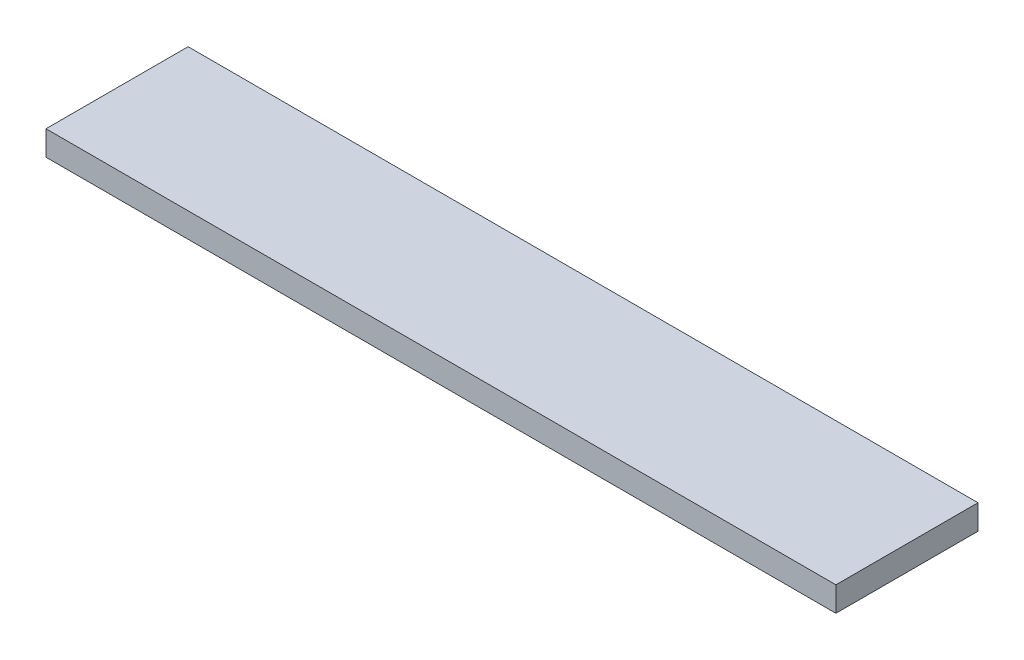
from build123d import *

# Parameters (mm, degrees)
SKETCH1_W           = 40.64
SKETCH1_H           = 7.311539518
BOSS_EXTRUDE1_DEPTH = 1.27


with BuildPart() as part:
    # Sketch1 → Boss-Extrude1 (new body)
    with BuildSketch(Plane(origin=(0, 0, 0), x_dir=(1, 0, 0), z_dir=(0, 1, 0))):
        with Locations((-15.067851264, 0)):
            Rectangle(SKETCH1_W, SKETCH1_H)
    extrude(amount=BOSS_EXTRUDE1_DEPTH)


solid = part.part
